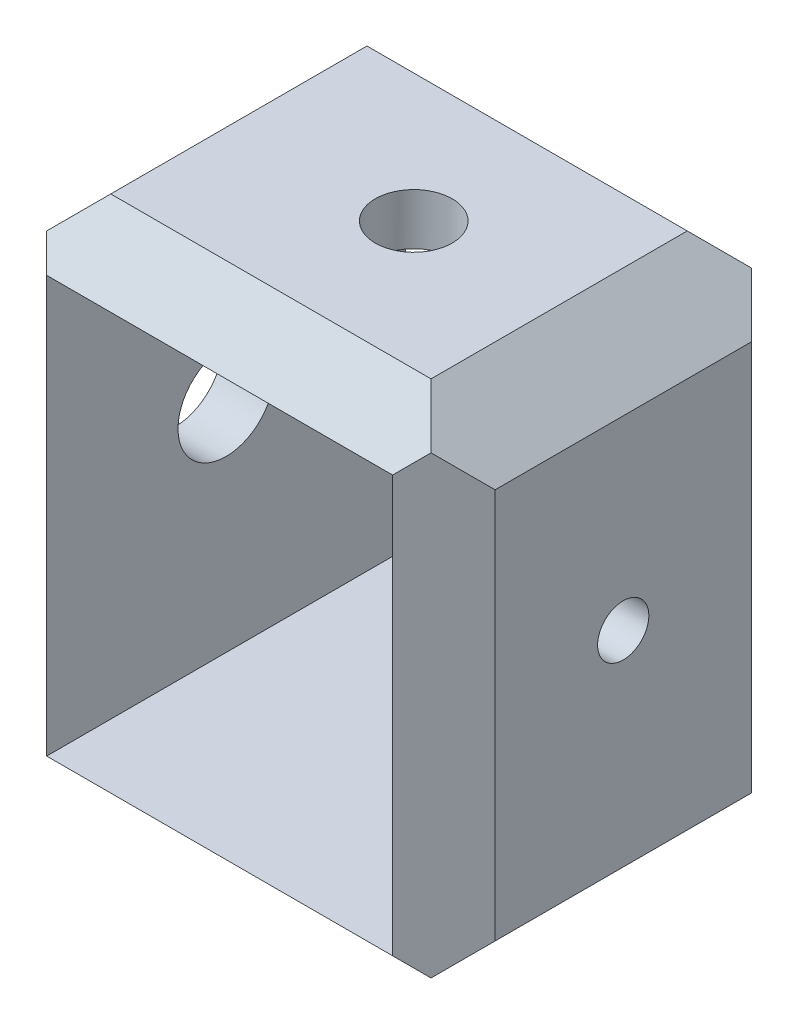
from build123d import *

# Parameters (mm, degrees)
SKETCH1_W           = 350
SKETCH1_H           = 405
SKETCH1_W_2         = 270
SKETCH1_H_2         = 325
BOSS_EXTRUDE1_DEPTH = 150
SKETCH2_R           = 37.5
CUT_EXTRUDE1_DEPTH  = 40
SKETCH3_R           = 20
CUT_EXTRUDE2_DEPTH  = 40
SKETCH4_R           = 30
CUT_EXTRUDE3_DEPTH  = 40
CHAMFER1_SIZE       = 50
CHAMFER2_SIZE       = 50
CHAMFER3_SIZE       = 50


with BuildPart() as part:
    # Sketch1 → Boss-Extrude1 (new, symmetric)
    with BuildSketch(Plane.XY):
        with Locations((42.392307941, -7.5)):
            Rectangle(SKETCH1_W, SKETCH1_H)
        with Locations((42.392307941, -7.5)):
            Rectangle(SKETCH1_W_2, SKETCH1_H_2, mode=Mode.SUBTRACT)
    extrude(amount=BOSS_EXTRUDE1_DEPTH, both=True)

    # Sketch2 → Cut-Extrude1 (cut)
    with BuildSketch(Plane.ZY.offset(132.607692059)):
        with Locations(Location((0, 0, 0), (0, 0, 270))):
            Circle(SKETCH2_R)
    extrude(amount=-CUT_EXTRUDE1_DEPTH, mode=Mode.SUBTRACT)

    # Sketch3 → Cut-Extrude2 (cut)
    with BuildSketch(Plane(origin=(217.392307941, 0, 0), x_dir=(0, 0, -1), z_dir=(1, 0, 0))):
        with Locations(Location((0, 0, 0), (0, 0, 90))):
            Circle(SKETCH3_R)
    extrude(amount=-CUT_EXTRUDE2_DEPTH, mode=Mode.SUBTRACT)

    # Sketch4 → Cut-Extrude3 (cut)
    with BuildSketch(Plane(origin=(0, 195, 0), x_dir=(1, 0, 0), z_dir=(0, 1, 0))):
        with Locations(Location((53.882307941, 0, 0), (0, 0, 270))):
            Circle(SKETCH4_R)
    extrude(amount=-CUT_EXTRUDE3_DEPTH, mode=Mode.SUBTRACT)

    # Chamfer1
    chamfer1_edges = [part.edges().sort_by_distance(p)[0] for p in [
        (-132.607692059, 195, 0),
        (217.392307941, 195, 0),
        (217.392307941, -210, 0),
        (-132.607692059, -210, 0),
    ]]
    chamfer(chamfer1_edges, length=CHAMFER1_SIZE)

    # Chamfer2
    # the kernel refuses this chamfer: 50 mm, written as the material it takes off along each edge
    with BuildSketch(Plane(origin=(295.97645734, -210, -150), x_dir=(0, 0.9996219169112966, -0.027495876610586587), z_dir=(-1, 0, 0)), Plane(origin=(-211.191841457, 195, 150), x_dir=(0, 0.027495876610586594, -0.9996219169112966), z_dir=(1, 0, 0))) as chamfer2_piece_1:
        Polygon((CHAMFER2_SIZE * 0.999621916911, -CHAMFER2_SIZE * 0.0274958766106), (-CHAMFER2_SIZE * 0.0274958766106, -CHAMFER2_SIZE * 0.999621916911), (0, 0), align=None)
    extrude(amount=507.168298797, mode=Mode.SUBTRACT)
    with BuildSketch(Plane(origin=(-211.191841457, 195, -150), x_dir=(0, 0.027495876610586594, 0.9996219169112966), z_dir=(1, 0, 0)), Plane(origin=(295.97645734, -210, 150), x_dir=(0, 0.9996219169112966, 0.027495876610586587), z_dir=(-1, 0, 0))) as chamfer2_piece_2:
        Polygon((CHAMFER2_SIZE * 0.999621916911, CHAMFER2_SIZE * 0.0274958766106), (-CHAMFER2_SIZE * 0.0274958766106, CHAMFER2_SIZE * 0.999621916911), (0, 0), align=None)
    extrude(amount=507.168298797, mode=Mode.SUBTRACT)

    # Chamfer3
    # the kernel refuses this chamfer: 50 mm, written as the material it takes off along each edge
    with BuildSketch(Plane(origin=(217.392307941, 273.584149398, 150), x_dir=(-0.9996219169112966, 0, 0.027495876610586587), z_dir=(0, -1, 0)), Plane(origin=(-132.607692059, -288.584149398, -150), x_dir=(-0.027495876610586594, 0, 0.9996219169112966), z_dir=(0, 1, 0)), Plane(origin=(217.392307941, 273.584149398, -150), x_dir=(0.027495876610586594, 0, 0.9996219169112966), z_dir=(0, -1, 0))) as chamfer3_piece_1:
        Polygon((CHAMFER3_SIZE * 0.999621916911, CHAMFER3_SIZE * 0.0274958766106), (-CHAMFER3_SIZE * 0.0274958766106, CHAMFER3_SIZE * 0.999621916911), (0, 0), align=None)
    extrude(amount=562.168298797, mode=Mode.SUBTRACT)
    with BuildSketch(Plane(origin=(-132.607692059, -288.584149398, 150), x_dir=(-0.027495876610586594, 0, -0.9996219169112966), z_dir=(0, 1, 0))) as chamfer3_piece_2:
        Polygon((CHAMFER3_SIZE * 0.999621916911, -CHAMFER3_SIZE * 0.0274958766106), (-CHAMFER3_SIZE * 0.0274958766106, -CHAMFER3_SIZE * 0.999621916911), (0, 0), align=None)
    extrude(amount=562.168298797, mode=Mode.SUBTRACT)


solid = part.part
